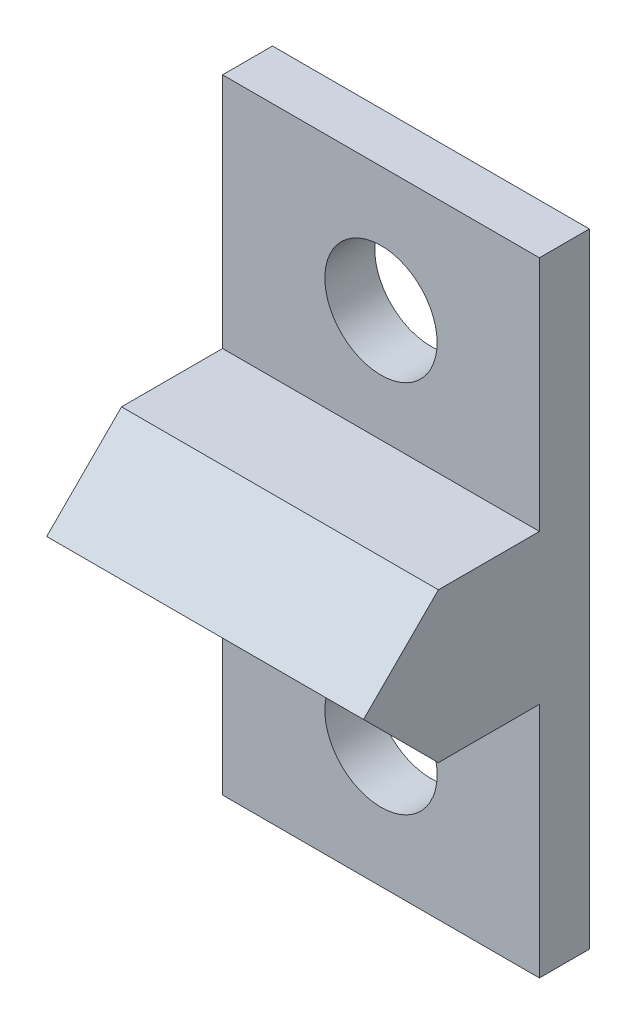
from build123d import *

# Parameters (mm, degrees)
SKETCH2_W           = 12.7
SKETCH2_H           = 25
SKETCH2_R           = 2.25
BOSS_EXTRUDE1_DEPTH = 2
SKETCH3_W           = 12.7
SKETCH3_H           = 6
BOSS_EXTRUDE2_DEPTH = 7.05
CHAMFER1_SIZE       = 3


with BuildPart() as part:
    # Sketch2 → Boss-Extrude1 (new body)
    with BuildSketch(Plane.XY):
        with Locations((0, 12.5)):
            Rectangle(SKETCH2_W, SKETCH2_H)
        with Locations((0, 5)):
            Circle(SKETCH2_R, mode=Mode.SUBTRACT)
        with Locations((0, 20)):
            Circle(SKETCH2_R, mode=Mode.SUBTRACT)
    extrude(amount=BOSS_EXTRUDE1_DEPTH)

    # Sketch3 → Boss-Extrude2 (add)
    with BuildSketch(Plane.XY.offset(2)):
        with Locations((0, 12.5)):
            Rectangle(SKETCH3_W, SKETCH3_H)
    extrude(amount=BOSS_EXTRUDE2_DEPTH)

    # Chamfer1
    chamfer1_edges = [part.edges().sort_by_distance(p)[0] for p in [
        (0, 9.5, 9.05),
        (0, 15.5, 9.05),
    ]]
    chamfer(chamfer1_edges, length=CHAMFER1_SIZE - 0.0001)  # a hair under: the kernel refuses the full size


solid = part.part
